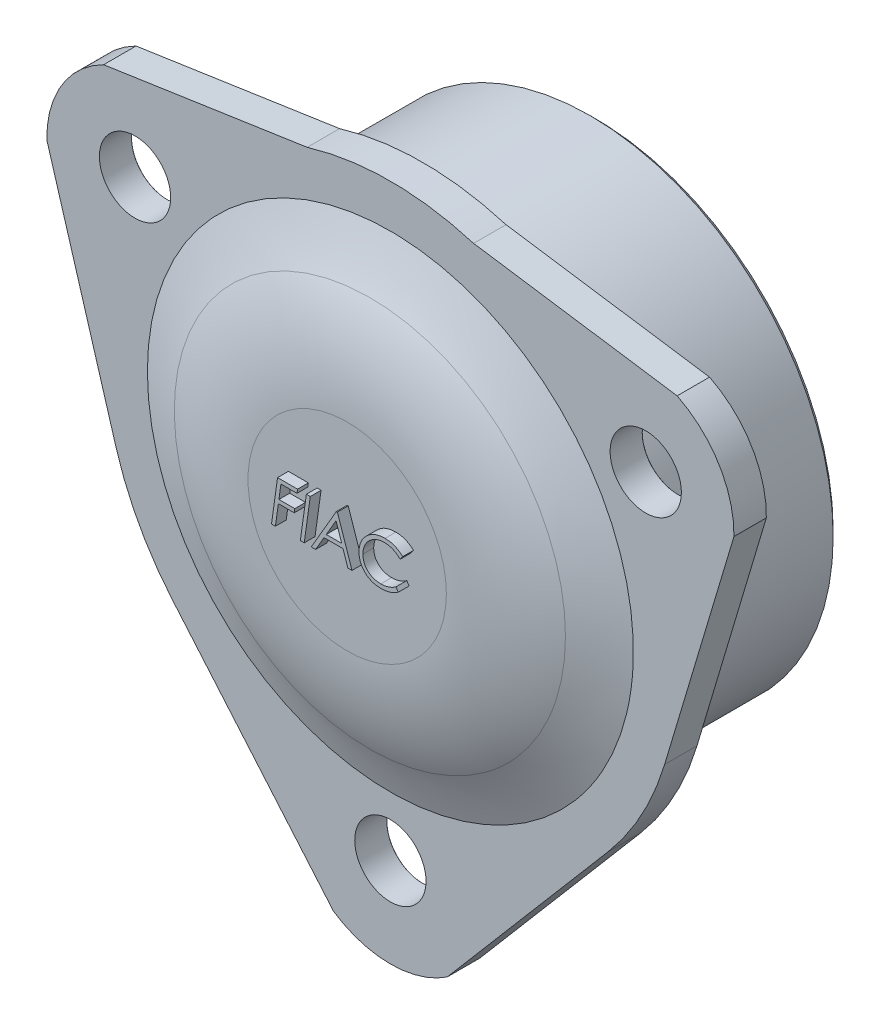
from build123d import *

# Parameters (mm, degrees)
ESTRUSIONE_ESTRUSIONE2_DEPTH   = 3
RACCORDO1_R                    = 20
FORO_PER_VITE_M6_1_D           = 6.6
FORO_PER_VITE_M6_1_CSINK_D     = 6.65
FORO_PER_VITE_M6_1_CSINK_ANGLE = 90
ESTRUSIONE_ESTRUSIONE4_DEPTH   = 1
SCHIZZO13_R                    = 22.5
SCHIZZO13_R_2                  = 20
ESTRUSIONE_ESTRUSIONE5_DEPTH   = 16
SMUSSO1_SIZE                   = 0.5
SCHIZZO14_R                    = 20
SCHIZZO14_R_2                  = 17
ESTRUSIONE_ESTRUSIONE6_DEPTH   = 4
SMUSSO2_SIZE                   = 0.5


with BuildPart() as part:
    # Schizzo2 → Estrusione-Estrusione2 (new body)
    with BuildSketch(Plane.XY):
        with BuildLine():
            Line((31.811628146, 90.400572067), (25.390622586, 68.91275513))
            ThreePointArc((25.390622586, 68.91275513), (23.282129475, 63.843284505), (20.174211359, 59.317124919))
            Line((20.174211359, 59.317124919), (5.259333821, 41.805742776))
            ThreePointArc((5.259333821, 41.805742776), (0, 40.217089549), (-5.259333821, 41.805742776))
            Line((-5.259333821, 41.805742776), (-20.174211359, 59.317124919))
            ThreePointArc((-20.174211359, 59.317124919), (-23.282129475, 63.843284505), (-25.390622586, 68.91275513))
            Line((-25.390622586, 68.91275513), (-31.811628146, 90.400572067))
            ThreePointArc((-31.811628146, 90.400572067), (-30.431228874, 95.486838044), (-26.552294326, 99.054676397))
            Line((-26.552294326, 99.054676397), (-7.704995257, 101.855138495))
            ThreePointArc((-7.704995257, 101.855138495), (0, 103), (7.704995257, 101.855138495))
            Line((7.704995257, 101.855138495), (26.552294326, 99.054676397))
            ThreePointArc((26.552294326, 99.054676397), (30.431228874, 95.486838044), (31.811628146, 90.400572067))
        make_face()
    extrude(amount=ESTRUSIONE_ESTRUSIONE2_DEPTH)

    # Loft1: read off the stored shape, not the designer's step
    # Loft1: loft between two sections, ruled curve by curve
    loft1_from = [
        Edge.make_bspline([(-20.945888845, 84.717039643, 3), (-37.37996813, 42.825261952, 3), (4.51180956, 26.391182667, 3), (20.945888845, 68.282960357, 3), (37.37996813, 110.174738048, 3), (-4.51180956, 126.608817333, 3), (-20.945888845, 84.717039643, 3)], [0, 0, 0, 0, 0.5, 0.5, 0.5, 1, 1, 1, 1], 3, [1, 0.333333333, 0.333333333, 1, 0.333333333, 0.333333333, 1]),
    ]
    loft1_to = [
        Edge.make_bspline([(-8.243217943, 89.031933528, 7), (-33.307084999, 72.545497643, 7), (-16.820649113, 47.481630587, 7), (8.243217943, 63.968066472, 7), (33.307084999, 80.454502357, 7), (16.820649113, 105.518369413, 7), (-8.243217943, 89.031933528, 7)], [0, 0, 0, 0, 0.5, 0.5, 0.5, 1, 1, 1, 1], 3, [1, 0.333333333, 0.333333333, 1, 0.333333333, 0.333333333, 1]),
    ]
    loft1 = Solid(Shell([*[Face.make_surface_from_curves(loft1_from[k], loft1_to[k]) for k in range(1)], Face(Wire(loft1_from)), Face(Wire(loft1_to))]))
    add(loft1)

    # Raccordo1
    raccordo1_edges = [part.edges().sort_by_distance(p)[0] for p in [
        (8.243217943, 63.968066472, 7),
    ]]
    fillet(raccordo1_edges, radius=RACCORDO1_R)

    # Foro per Vite M6-1 (through all)
    with Locations(Plane(origin=(0, 0, 0), x_dir=(-1, 0, 0), z_dir=(0, 0, -1))):
        with Locations((-23.643180835, 91.5), (23.643180835, 91.5), (0, 48.5)):
            CounterSinkHole(FORO_PER_VITE_M6_1_D / 2, FORO_PER_VITE_M6_1_CSINK_D / 2, counter_sink_angle=FORO_PER_VITE_M6_1_CSINK_ANGLE)

    # Schizzo12 → Estrusione-Estrusione4 (add)
    # profile 1 of 4: a face of its own
    with BuildSketch(Plane.XY.offset(7)):
        Polygon((-3.596129901, 79), (-3.645008106, 78.641025641), (-5.13459144, 78.641025641), (-5.32209144, 77.307692308), (-3.852540158, 77.307692308), (-3.901418363, 76.948717949), (-5.371770927, 76.948717949), (-5.645008106, 75), (-6.006386312, 75), (-5.445488876, 79), align=None)
    # profile 2 of 4: a face of its own
    with BuildSketch(Plane.XY.offset(7)):
        Polygon((-2.778822209, 79), (-2.417444004, 79), (-2.97834144, 75), (-3.339719645, 75), align=None)
    # profile 3 of 4: a face of its own
    with BuildSketch(Plane.XY.offset(7)):
        Polygon((0.091370099, 79), (1.442331637, 75), (1.066530355, 75), (0.61540856, 76.333333333), (-1.145008106, 76.333333333), (-1.91984785, 75), (-2.326899132, 75), (-0.000777337, 79), align=None)
        Polygon((-0.032027337, 78.249198718), (-0.936674773, 76.692307692), (0.493613688, 76.692307692), align=None, mode=Mode.SUBTRACT)
    # profile 4 of 4: a face of its own
    with BuildSketch(Plane.XY.offset(7)):
        with BuildLine():
            Line((6.147459842, 78.461538462), (5.907075227, 78.128205128))
            add(Edge.make_bspline(
                [(5.907075227, 78.128205128), (5.853409068, 78.177252377), (5.748139309, 78.273461837), (5.57859512, 78.399066357), (5.403488099, 78.505445152), (5.22256522, 78.592311905), (5.036140145, 78.660469488), (4.844086397, 78.708187014), (4.646272643, 78.738264389), (4.512418126, 78.741801319), (4.444735483, 78.743589744)],
                knots=[0, 0, 0, 0, 1.071509858, 2.101838265, 3.105566767, 4.088534008, 5.056617788, 6.027134063, 7.002433514, 8, 8, 8, 8], degree=3))
            add(Edge.make_bspline(
                [(4.444735483, 78.743589744), (4.400373208, 78.742812621), (4.312286158, 78.741269543), (4.181334262, 78.729117344), (4.052913927, 78.708126456), (3.926602012, 78.679162503), (3.802411907, 78.64228048), (3.680155963, 78.597516258), (3.56054902, 78.543286131), (3.443628937, 78.482044458), (3.330601048, 78.414350152), (3.22428905, 78.33952652), (3.12333878, 78.259946704), (3.028834556, 78.174521349), (2.941380069, 78.082399604), (2.859264786, 77.98583622), (2.78482907, 77.882456135), (2.716015178, 77.774823109), (2.654558753, 77.663275365), (2.601448097, 77.548895655), (2.556421412, 77.432470171), (2.519611274, 77.31384374), (2.490613909, 77.193141896), (2.46962503, 77.070318011), (2.457497057, 76.945226207), (2.455936033, 76.861136633), (2.45515215, 76.818910256)],
                knots=[0, 0, 0, 0, 1.038808894, 2.06268977, 3.07662516, 4.084154014, 5.095481367, 6.108721937, 7.130613802, 8.168612606, 9.198437467, 10.213568377, 11.210969095, 12.207329739, 13.193903721, 14.183803377, 15.173465855, 16.174683957, 17.174102854, 18.153572289, 19.125845025, 20.09527659, 21.060177321, 22.030919679, 23.011207659, 24, 24, 24, 24], degree=3))
            add(Edge.make_bspline(
                [(2.45515215, 76.818910256), (2.455723998, 76.781491738), (2.456853287, 76.707597462), (2.467137224, 76.598513496), (2.481582904, 76.492331052), (2.504695805, 76.389786519), (2.532296075, 76.289652842), (2.567790414, 76.19322547), (2.608704098, 76.099685037), (2.655827766, 76.009788748), (2.709981947, 75.9244307), (2.767825544, 75.84203868), (2.833376205, 75.766228724), (2.903469648, 75.69420712), (2.979271851, 75.626878672), (3.06172917, 75.565604987), (3.148109174, 75.50693934), (3.241284048, 75.455918021), (3.337713946, 75.407825191), (3.439192633, 75.368472345), (3.543314355, 75.333536855), (3.651321135, 75.30582883), (3.762449094, 75.282865419), (3.877406714, 75.268399012), (3.995297146, 75.258117436), (4.075054043, 75.256983827), (4.11540856, 75.256410256)],
                knots=[0, 0, 0, 0, 1.050288761, 2.074115449, 3.074185512, 4.056755159, 5.022963132, 5.98847243, 6.938717655, 7.888015535, 8.834733031, 9.775342319, 10.711547043, 11.644864095, 12.595819208, 13.554196408, 14.527565762, 15.524707521, 16.534208059, 17.550758617, 18.577574426, 19.616152416, 20.679451723, 21.761233178, 22.867253411, 24, 24, 24, 24], degree=3))
            add(Edge.make_bspline(
                [(4.11540856, 75.256410256), (4.177436651, 75.257790942), (4.301068501, 75.260542869), (4.484631477, 75.282868048), (4.664978891, 75.318865819), (4.842002444, 75.369810901), (5.016050431, 75.43453316), (5.186569599, 75.514843771), (5.354579597, 75.607897574), (5.461316993, 75.681008093), (5.515248304, 75.717948718)],
                knots=[0, 0, 0, 0, 0.99335309, 1.979910703, 2.957437189, 3.936535413, 4.927536167, 5.928599034, 6.953381172, 8, 8, 8, 8], degree=3))
            Line((5.515248304, 75.717948718), (5.737203432, 75.401442308))
            add(Edge.make_bspline(
                [(5.737203432, 75.401442308), (5.698636022, 75.377400999), (5.623207082, 75.330381758), (5.510173423, 75.266138874), (5.402305276, 75.206488418), (5.298337121, 75.153355463), (5.198579513, 75.105882334), (5.1023715, 75.065337735), (5.011000051, 75.029494384), (4.892992217, 74.990590306), (4.74133145, 74.952952634), (4.550453852, 74.92005811), (4.346035685, 74.900897129), (4.205459903, 74.898612773), (4.133036765, 74.897435897)],
                knots=[0, 0, 0, 0, 0.95718736, 1.872037221, 2.738173064, 3.553405217, 4.331061281, 5.064628489, 5.752111019, 6.397930214, 7.680580555, 9.03930081, 10.474679465, 12, 12, 12, 12], degree=3))
            add(Edge.make_bspline(
                [(4.133036765, 74.897435897), (4.065668797, 74.898503504), (3.933826188, 74.900592864), (3.741149364, 74.921710204), (3.557866827, 74.95258651), (3.384436033, 74.999139462), (3.219772984, 75.056693596), (3.065642403, 75.129864143), (2.919625803, 75.213209751), (2.831076482, 75.280512719), (2.786882919, 75.314102564)],
                knots=[0, 0, 0, 0, 1.124936831, 2.201559726, 3.234383979, 4.226808245, 5.197736629, 6.143845973, 7.073622924, 8, 8, 8, 8], degree=3))
            add(Edge.make_bspline(
                [(2.786882919, 75.314102564), (2.758885291, 75.337621958), (2.703394402, 75.384237053), (2.62470229, 75.457997227), (2.551570012, 75.534983994), (2.484244847, 75.615533524), (2.42157733, 75.698321851), (2.365717698, 75.784759584), (2.313562827, 75.872994881), (2.268800829, 75.96512557), (2.22697839, 76.059317323), (2.192210864, 76.156942995), (2.16224319, 76.257459522), (2.138526146, 76.361127608), (2.119099109, 76.4674919), (2.105596966, 76.576905953), (2.097360113, 76.688973096), (2.09657437, 76.764675934), (2.096177791, 76.802884615)],
                knots=[0, 0, 0, 0, 1.031438255, 2.044295521, 3.04101972, 4.02510288, 5.004675323, 5.96814667, 6.927099159, 7.894246712, 8.855978008, 9.833229186, 10.815522105, 11.813498757, 12.831862773, 13.86462134, 14.922233219, 16, 16, 16, 16], degree=3))
            add(Edge.make_bspline(
                [(2.096177791, 76.802884615), (2.096577495, 76.842428296), (2.097372344, 76.921064649), (2.105650778, 77.037926676), (2.119089644, 77.152678707), (2.138604556, 77.264900109), (2.162372252, 77.374931575), (2.192108962, 77.482456198), (2.227496183, 77.587819052), (2.26846739, 77.690912174), (2.313946089, 77.792253604), (2.365597569, 77.890641468), (2.421437188, 77.987446425), (2.484309495, 78.080807656), (2.551867712, 78.172560242), (2.624363598, 78.262330978), (2.703619519, 78.348673131), (2.786172336, 78.433454544), (2.873429547, 78.514127778), (2.963688628, 78.590231175), (3.057030633, 78.660704389), (3.152310494, 78.726903249), (3.250787182, 78.786579776), (3.351531447, 78.841522422), (3.455054871, 78.891215855), (3.561207816, 78.935892226), (3.669937102, 78.975588021), (3.781394211, 79.008879856), (3.895516006, 79.0378999), (4.012061865, 79.061869924), (4.131310009, 79.08051087), (4.253292706, 79.092904794), (4.377840673, 79.101419939), (4.461815011, 79.102181335), (4.504030355, 79.102564103)],
                knots=[0, 0, 0, 0, 1.022044487, 2.032432208, 3.026697584, 4.007398125, 4.975698324, 5.935493653, 6.889610259, 7.847342231, 8.802158043, 9.759466851, 10.718641154, 11.689497925, 12.667180171, 13.663528933, 14.670419348, 15.695700261, 16.721678344, 17.740943913, 18.746223377, 19.744006424, 20.738655278, 21.721128384, 22.709310215, 23.705658978, 24.697235847, 25.699785021, 26.711210149, 27.740296491, 28.77439654, 29.829646392, 30.908925919, 32, 32, 32, 32], degree=3))
            add(Edge.make_bspline(
                [(4.504030355, 79.102564103), (4.580506116, 79.101020619), (4.730225931, 79.097998876), (4.949594324, 79.069889673), (5.158458449, 79.024831724), (5.324999268, 78.970585793), (5.454290614, 78.917658056), (5.552043217, 78.87243398), (5.649557753, 78.818839919), (5.748433722, 78.760454716), (5.84769365, 78.695580135), (5.947481515, 78.623682671), (6.04797544, 78.545625981), (6.1139998, 78.48982), (6.147459842, 78.461538462)],
                knots=[0, 0, 0, 0, 1.522680585, 2.981015879, 4.397098697, 5.773315249, 6.462902712, 7.179304435, 7.917249996, 8.678195189, 9.466166505, 10.278195975, 11.127418496, 12, 12, 12, 12], degree=3))
        make_face()
    extrude(amount=ESTRUSIONE_ESTRUSIONE4_DEPTH)

    # Schizzo13 → Estrusione-Estrusione5 (add)
    with BuildSketch(Plane(origin=(0, 0, 0), x_dir=(-1, 0, 0), z_dir=(0, 0, -1))):
        with Locations(Location((0, 76.5, 0), (0, 0, 180))):
            Circle(SCHIZZO13_R)
        with Locations((0, 76.5)):
            Circle(SCHIZZO13_R_2, mode=Mode.SUBTRACT)
    extrude(amount=ESTRUSIONE_ESTRUSIONE5_DEPTH)

    # Smusso1
    smusso1_edges = [part.edges().sort_by_distance(p)[0] for p in [
        (-22.5, 76.5, -16),
        (20, 76.5, -16),
    ]]
    chamfer(smusso1_edges, length=SMUSSO1_SIZE)

    # Schizzo14 → Estrusione-Estrusione6 (add)
    with BuildSketch(Plane(origin=(0, 0, 0), x_dir=(-1, 0, 0), z_dir=(0, 0, -1))):
        with Locations((0, 76.5)):
            Circle(SCHIZZO14_R)
        with Locations((0, 76.5)):
            Circle(SCHIZZO14_R_2, mode=Mode.SUBTRACT)
    extrude(amount=ESTRUSIONE_ESTRUSIONE6_DEPTH)

    # Smusso2
    smusso2_edges = [part.edges().sort_by_distance(p)[0] for p in [
        (17, 76.5, -4),
    ]]
    chamfer(smusso2_edges, length=SMUSSO2_SIZE)


solid = part.part
